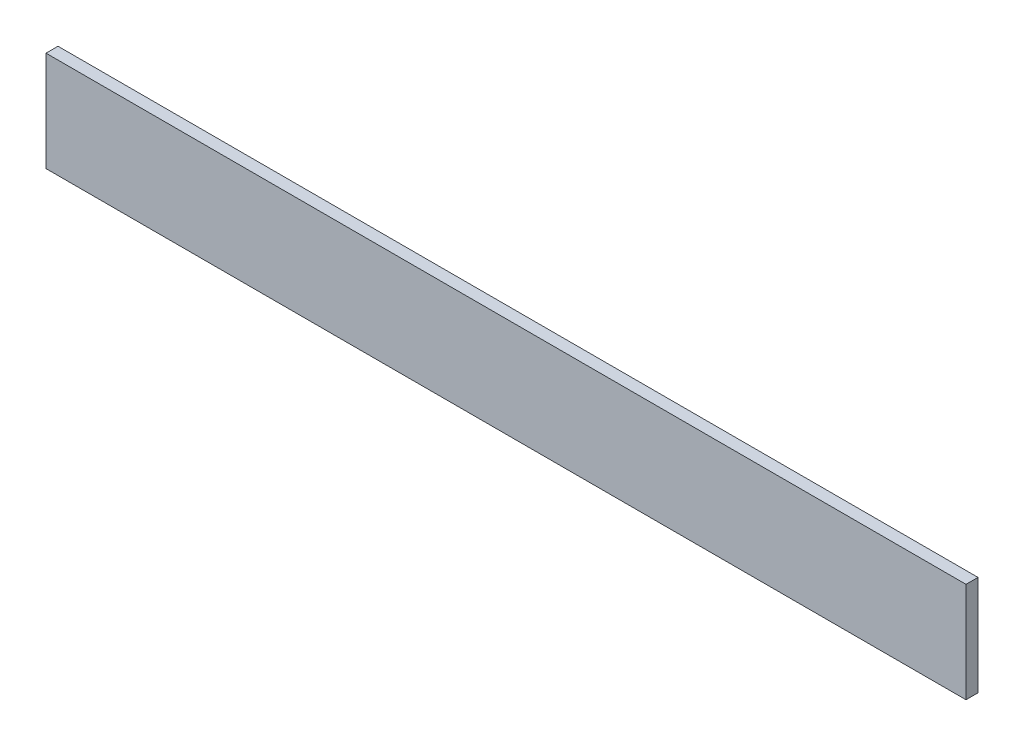
from build123d import *

# Parameters (mm, degrees)
SKETCH1_W           = 230
SKETCH1_H           = 25
BOSS_EXTRUDE1_DEPTH = 3


with BuildPart() as part:
    # Sketch1 → Boss-Extrude1 (new body)
    with BuildSketch(Plane.XY):
        Rectangle(SKETCH1_W, SKETCH1_H)
    extrude(amount=BOSS_EXTRUDE1_DEPTH)


solid = part.part
